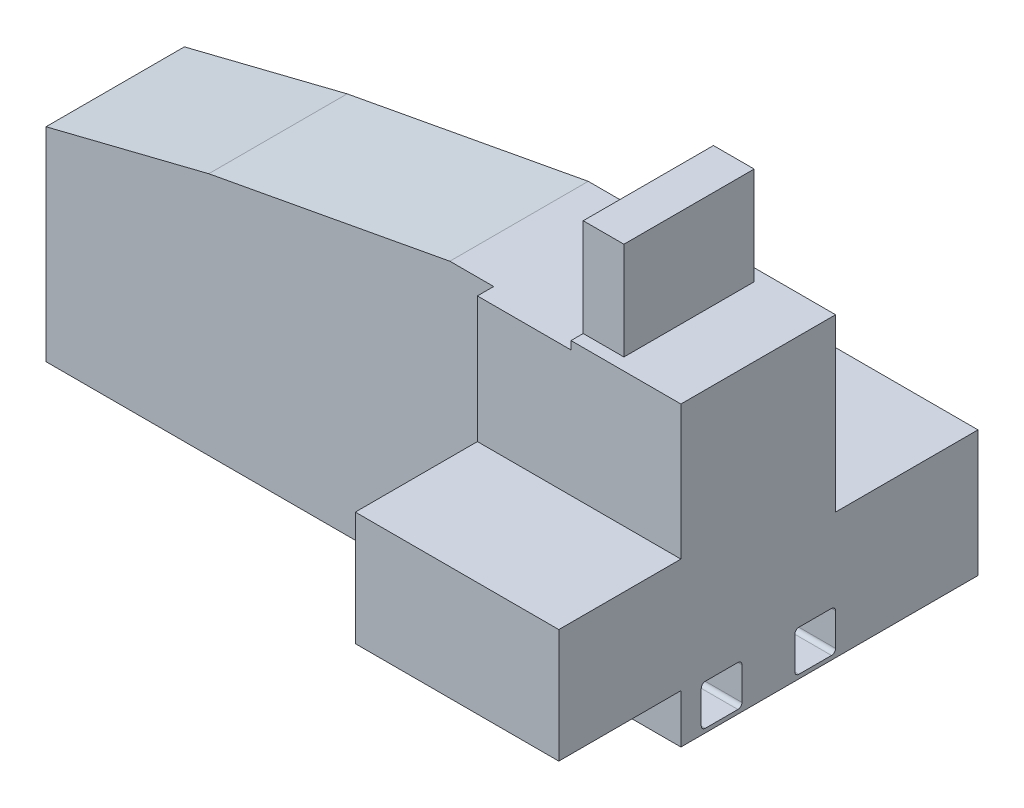
from build123d import *

# Parameters (mm, degrees)
BOSS_EXTRUDE1_DEPTH     = 970
CUT_EXTRUDE1_DEPTH      = 1359.721825835
CUT_EXTRUDE1_DEPTH_BACK = 1359.721825835
CUT_EXTRUDE5_DEPTH      = 1625
SKETCH4_R               = 8.5
CUT_EXTRUDE6_DEPTH      = 78
SKETCH5_W               = 170
SKETCH5_H               = 240
SKETCH5_W_2             = 375
SKETCH5_H_2             = 260
CUT_EXTRUDE8_DEPTH      = 1478
SKETCH6_OUTSIDE_W       = 2029.168
SKETCH6_OUTSIDE_H       = 1459.168
SKETCH6_OUTSIDE_W_2     = 100
SKETCH6_OUTSIDE_H_2     = 320
CUT_EXTRUDE9_DEPTH      = 240
SKETCH7_W               = 300
SKETCH7_H               = 120
SKETCH7_H_2             = 330
SKETCH7_W_2             = 350
SKETCH7_H_3             = 420
CUT_EXTRUDE10_DEPTH     = 1941.650664082


with BuildPart() as part:
    # Sketch2 → Boss-Extrude1 (new body)
    with BuildSketch(Plane(origin=(0, 0, 0), x_dir=(1, 0, 0), z_dir=(0, 1, 0))):
        Polygon((300, -515), (800, -515), (800, 515), (300, 515), (300, 175), (-404, 175), (-404, 355), (-525, 355), (-525, 175), (-800, 175), (-800, -175), (300, -175), align=None)
    extrude(amount=BOSS_EXTRUDE1_DEPTH)

    # Sketch1 → Cut-Extrude1 (cut, two sides: drawn at the far end of the back side and taken through both)
    with BuildSketch(Plane.XY.offset(-CUT_EXTRUDE1_DEPTH_BACK)):
        Polygon((-800, 970), (-800, 500), (-400, 600), (300, 730), (530, 970), align=None)
    extrude(amount=CUT_EXTRUDE1_DEPTH + CUT_EXTRUDE1_DEPTH_BACK, mode=Mode.SUBTRACT)

    # Sketch3 → Cut-Extrude5 (cut)
    with BuildSketch(Plane.ZY.offset(800)):
        with BuildLine():
            ThreePointArc((-155, 110), (-162.071067812, 107.071067812), (-165, 100))
            Line((-165, 100), (-165, 20))
            ThreePointArc((-165, 20), (-162.071067812, 12.928932188), (-155, 10))
            Line((-155, 10), (-75, 10))
            ThreePointArc((-75, 10), (-67.928932188, 12.928932188), (-65, 20))
            Line((-65, 20), (-65, 100))
            ThreePointArc((-65, 100), (-67.928932188, 107.071067812), (-75, 110))
            Line((-75, 110), (-155, 110))
        make_face()
        with BuildLine():
            Line((155, 110), (75, 110))
            ThreePointArc((75, 110), (67.928932188, 107.071067812), (65, 100))
            Line((65, 100), (65, 20))
            ThreePointArc((65, 20), (67.928932188, 12.928932188), (75, 10))
            Line((75, 10), (155, 10))
            ThreePointArc((155, 10), (162.071067812, 12.928932188), (165, 20))
            Line((165, 20), (165, 100))
            ThreePointArc((165, 100), (162.071067812, 107.071067812), (155, 110))
        make_face()
    extrude(amount=-CUT_EXTRUDE5_DEPTH, mode=Mode.SUBTRACT)

    # Sketch4 → Cut-Extrude6 (cut)
    with BuildSketch(Plane.XZ):
        with Locations((-498.5, 115)):
            Circle(SKETCH4_R)
        with Locations((-501, -115)):
            Circle(SKETCH4_R)
        with Locations((501, -115)):
            Circle(SKETCH4_R)
        with Locations((498.5, 115)):
            Circle(SKETCH4_R)
    extrude(amount=-CUT_EXTRUDE6_DEPTH, mode=Mode.SUBTRACT)

    # Sketch5 → Cut-Extrude8 (cut)
    with BuildSketch(Plane.XY.offset(515)):
        with Locations((715, 850)):
            Rectangle(SKETCH5_W, SKETCH5_H)
        with Locations((342.5, 840)):
            Rectangle(SKETCH5_W_2, SKETCH5_H_2)
    extrude(amount=-CUT_EXTRUDE8_DEPTH, mode=Mode.SUBTRACT)

    # Sketch6 outside → Cut-Extrude9 (cut)
    with BuildSketch(Plane(origin=(0, 970, 0), x_dir=(1, 0, 0), z_dir=(0, 1, 0))):
        Rectangle(SKETCH6_OUTSIDE_W, SKETCH6_OUTSIDE_H)
        with Locations((580, -25)):
            Rectangle(SKETCH6_OUTSIDE_W_2, SKETCH6_OUTSIDE_H_2, mode=Mode.SUBTRACT)
    extrude(amount=-CUT_EXTRUDE9_DEPTH, mode=Mode.SUBTRACT)

    # Sketch7 → Cut-Extrude10 (cut, through all)
    with BuildSketch(Plane(origin=(800, 0, 0), x_dir=(0, 0, -1), z_dir=(1, 0, 0))):
        with Locations((-365, 60)):
            Rectangle(SKETCH7_W, SKETCH7_H)
        with Locations((-365, 565)):
            Rectangle(SKETCH7_W, SKETCH7_H_2)
        with Locations((340, 520)):
            Rectangle(SKETCH7_W_2, SKETCH7_H_3)
    extrude(amount=-CUT_EXTRUDE10_DEPTH, mode=Mode.SUBTRACT)


solid = part.part
